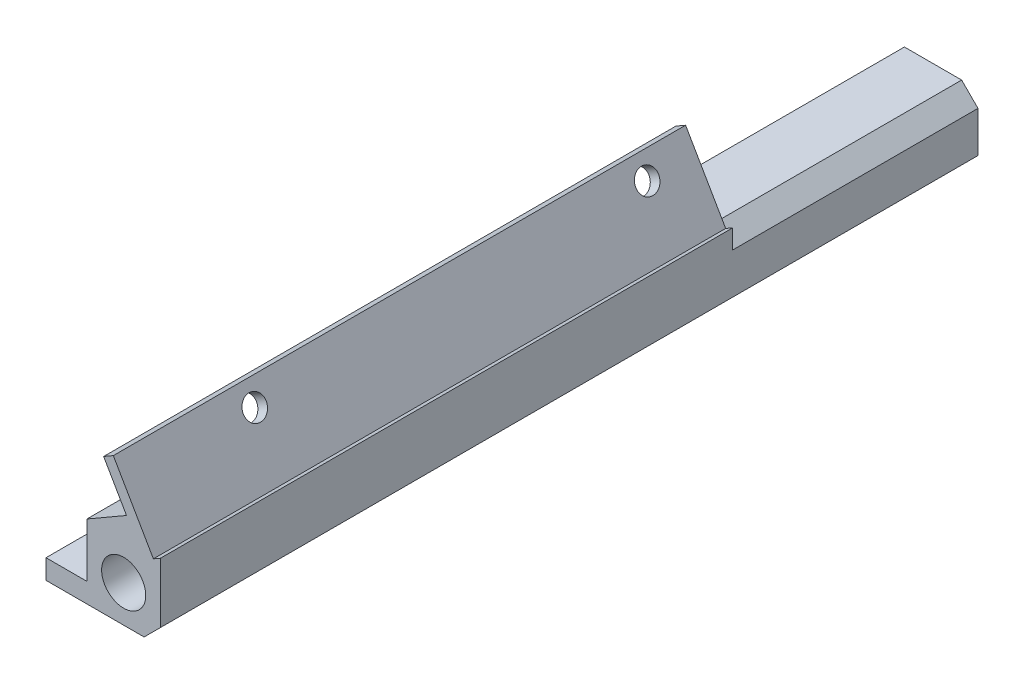
from build123d import *

# Parameters (mm, degrees)
SKETCH1_W           = 77.47
SKETCH1_H           = 127
BOSS_EXTRUDE1_DEPTH = 11.43
SKETCH2_R           = 3.429
CUT_EXTRUDE1_DEPTH  = 150.202030147
CUT_EXTRUDE2_DEPTH  = 150.202030147
SKETCH4_W           = 54.61
SKETCH4_H           = 6.35
CUT_EXTRUDE3_DEPTH  = 150.202030147
CHAMFER1_SIZE       = 2.54
SKETCH5_W           = 66.04
SKETCH5_H           = 50.8
CUT_EXTRUDE4_DEPTH  = 150.202030147
SKETCH6_W           = 53.34
SKETCH6_H           = 76.2
CUT_EXTRUDE5_DEPTH  = 150.202030147
SKETCH7_R           = 1.778
HOLE_CUTS_1_DEPTH   = 149.899037606
BOSS_EXTRUDE2_DEPTH = 88.9
CUT_EXTRUDE7_REACH  = 152.316
SKETCH9_W           = 6.35
SKETCH9_H           = 5.08
CUT_EXTRUDE8_REACH  = 152.316
SKETCH10_W          = 6.35
SKETCH10_H          = 1.27
HOLE_CUTS_2_REACH   = 134.793
SKETCH11_R          = 1.778
SKETCH12_W          = 88.9
SKETCH12_H          = 11.176
CUT_EXTRUDE10_DEPTH = 1.27
SKETCH13_W          = 88.9
SKETCH13_H          = 5.842
CUT_EXTRUDE11_DEPTH = 0.762
SKETCH14_W          = 6.35
SKETCH14_H          = 76.2
CUT_EXTRUDE12_DEPTH = 0.762
SKETCH15_W          = 1.736640818
SKETCH15_H          = 88.9
BOSS_EXTRUDE3_DEPTH = 1.27


with BuildPart() as part:
    # Sketch1 → Boss-Extrude1 (new body)
    with BuildSketch(Plane(origin=(0, 0, 0), x_dir=(1, 0, 0), z_dir=(0, 1, 0))):
        with Locations((38.735, 63.5)):
            Rectangle(SKETCH1_W, SKETCH1_H)
    extrude(amount=BOSS_EXTRUDE1_DEPTH)

    # Sketch2 → Cut-Extrude1 (cut, through all)
    with BuildSketch(Plane.XY):
        with Locations((5.715, 5.715)):
            Circle(SKETCH2_R)
        with Locations((71.755, 5.715)):
            Circle(SKETCH2_R)
    extrude(amount=-CUT_EXTRUDE1_DEPTH, mode=Mode.SUBTRACT)

    # Sketch3 → Cut-Extrude2 (cut, through all)
    with BuildSketch(Plane(origin=(0, 11.43, 0), x_dir=(1, 0, 0), z_dir=(0, 1, 0))):
        with BuildLine():
            Line((11.43, 127), (11.43, 88.9))
            ThreePointArc((11.43, 88.9), (15.149743879, 79.919743879), (24.13, 76.2))
            Line((24.13, 76.2), (53.34, 76.2))
            ThreePointArc((53.34, 76.2), (62.320256121, 79.919743879), (66.04, 88.9))
            Line((66.04, 88.9), (66.04, 127))
            Line((66.04, 127), (11.43, 127))
        make_face()
    extrude(amount=-CUT_EXTRUDE2_DEPTH, mode=Mode.SUBTRACT)

    # Sketch4 → Cut-Extrude3 (cut, through all)
    with BuildSketch(Plane(origin=(0, 0, -127), x_dir=(-1, 0, 0), z_dir=(0, 0, -1))):
        with Locations((-38.735, 8.255)):
            Rectangle(SKETCH4_W, SKETCH4_H)
    extrude(amount=-CUT_EXTRUDE3_DEPTH, mode=Mode.SUBTRACT)

    # Chamfer1
    chamfer1_edges = [part.edges().sort_by_distance(p)[0] for p in [
        (0, 0, -63.5),
        (0, 11.43, -63.5),
        (77.47, 0, -63.5),
        (77.47, 11.43, -63.5),
    ]]
    chamfer(chamfer1_edges, length=CHAMFER1_SIZE)

    # Sketch5 → Cut-Extrude4 (cut, through all)
    with BuildSketch(Plane(origin=(0, 11.43, 0), x_dir=(1, 0, 0), z_dir=(0, 1, 0))):
        with Locations((33.02, 101.6)):
            Rectangle(SKETCH5_W, SKETCH5_H)
    extrude(amount=-CUT_EXTRUDE4_DEPTH, mode=Mode.SUBTRACT)

    # Sketch6 → Cut-Extrude5 (cut, through all)
    with BuildSketch(Plane(origin=(0, 11.43, 0), x_dir=(1, 0, 0), z_dir=(0, 1, 0))):
        with Locations((26.67, 38.1)):
            Rectangle(SKETCH6_W, SKETCH6_H)
    extrude(amount=-CUT_EXTRUDE5_DEPTH, mode=Mode.SUBTRACT)

    # Sketch7 → Hole Cuts 1 (cut, through all)
    with BuildSketch(Plane(origin=(0, 5.08, 0), x_dir=(1, 0, 0), z_dir=(0, 1, 0))):
        with Locations((62.23, 68.58)):
            Circle(SKETCH7_R)
        with Locations((62.23, 7.62)):
            Circle(SKETCH7_R)
    extrude(amount=-HOLE_CUTS_1_DEPTH, mode=Mode.SUBTRACT)

    # Sketch8 → Boss-Extrude2 (add)
    with BuildSketch(Plane.XY):
        Polygon((77.47, 11.869940905), (77.47, 7.030590949), (74.93, 11.43), (66.04, 11.43), (71.539261314, 14.605), (68.618261314, 19.664320409), (71.882, 21.548640818), align=None)
    extrude(amount=-BOSS_EXTRUDE2_DEPTH)

    # Sketch9 → Cut-Extrude7 (cut, up to next)
    with BuildSketch(Plane.XY, mode=Mode.PRIVATE) as cut_extrude7_sk1:
        with Locations((56.515, 2.54)):
            Rectangle(SKETCH9_W, SKETCH9_H)
    cut_extrude7_tool1 = extrude(cut_extrude7_sk1.sketch, amount=-CUT_EXTRUDE7_REACH, mode=Mode.PRIVATE) & part.part
    add(cut_extrude7_tool1.solids().sort_by_distance((56.515, 2.54, 0))[0], mode=Mode.SUBTRACT)

    # Sketch10 → Cut-Extrude8 (cut, up to next)
    with BuildSketch(Plane.XY, mode=Mode.PRIVATE) as cut_extrude8_sk1:
        with Locations((62.865, 4.445)):
            Rectangle(SKETCH10_W, SKETCH10_H)
    cut_extrude8_tool1 = extrude(cut_extrude8_sk1.sketch, amount=-CUT_EXTRUDE8_REACH, mode=Mode.PRIVATE) & part.part
    add(cut_extrude8_tool1.solids().sort_by_distance((62.865, 4.445, 0))[0], mode=Mode.SUBTRACT)

    # Sketch11 → Hole Cuts 2 (cut, up to next)
    with BuildSketch(Plane(origin=(59.978596497, 34.628658833, 0), x_dir=(0, 0, 1), z_dir=(-0.8660254037844403, -0.49999999999999745, 0)), mode=Mode.PRIVATE) as hole_cuts_2_sk1:
        with Locations((-20.32, -19.311329635)):
            Circle(SKETCH11_R)
    hole_cuts_2_tool1 = extrude(hole_cuts_2_sk1.sketch, amount=-HOLE_CUTS_2_REACH, mode=Mode.PRIVATE) & part.part
    # Sketch11 → Hole Cuts 2 (cut, up to next)
    with BuildSketch(Plane(origin=(59.978596497, 34.628658833, 0), x_dir=(0, 0, 1), z_dir=(-0.8660254037844403, -0.49999999999999745, 0)), mode=Mode.PRIVATE) as hole_cuts_2_sk2:
        with Locations((-81.28, -19.311329635)):
            Circle(SKETCH11_R)
    hole_cuts_2_tool2 = extrude(hole_cuts_2_sk2.sketch, amount=-HOLE_CUTS_2_REACH, mode=Mode.PRIVATE) & part.part
    add(hole_cuts_2_tool1.solids().sort_by_distance((69.634261, 17.904557, -20.32))[0], mode=Mode.SUBTRACT)
    add(hole_cuts_2_tool2.solids().sort_by_distance((69.634261, 17.904557, -81.28))[0], mode=Mode.SUBTRACT)

    # Sketch12 → Cut-Extrude10 (cut)
    with BuildSketch(Plane(origin=(63.242335183, 36.512979242, 0), x_dir=(0, 0, -1), z_dir=(0.8660254037844395, 0.49999999999999856, 0))):
        with Locations((44.45, -22.867329635)):
            Rectangle(SKETCH12_W, SKETCH12_H)
    extrude(amount=-CUT_EXTRUDE10_DEPTH, mode=Mode.SUBTRACT)

    # Sketch13 → Cut-Extrude11 (cut)
    with BuildSketch(Plane(origin=(59.978596497, 34.628658833, 0), x_dir=(0, 0, 1), z_dir=(-0.8660254037844393, -0.49999999999999906, 0))):
        with Locations((-44.45, -20.200329635)):
            Rectangle(SKETCH13_W, SKETCH13_H)
    extrude(amount=-CUT_EXTRUDE11_DEPTH, mode=Mode.SUBTRACT)

    # Sketch14 → Cut-Extrude12 (cut)
    with BuildSketch(Plane(origin=(0, 3.81, 0), x_dir=(1, 0, 0), z_dir=(0, 1, 0))):
        with Locations((62.865, 38.1)):
            Rectangle(SKETCH14_W, SKETCH14_H)
    extrude(amount=-CUT_EXTRUDE12_DEPTH, mode=Mode.SUBTRACT)

    # Sketch15 → Boss-Extrude3 (add)
    with BuildSketch(Plane(origin=(8.639664817, -14.964338424, 0), x_dir=(0.8660254037844382, 0.500000000000001, 0), z_dir=(-0.5000000000000009, 0.866025403784438, 0))):
        with Locations((70.887638075, 44.45)):
            Rectangle(SKETCH15_W, SKETCH15_H)
    extrude(amount=BOSS_EXTRUDE3_DEPTH)


solid = part.part
